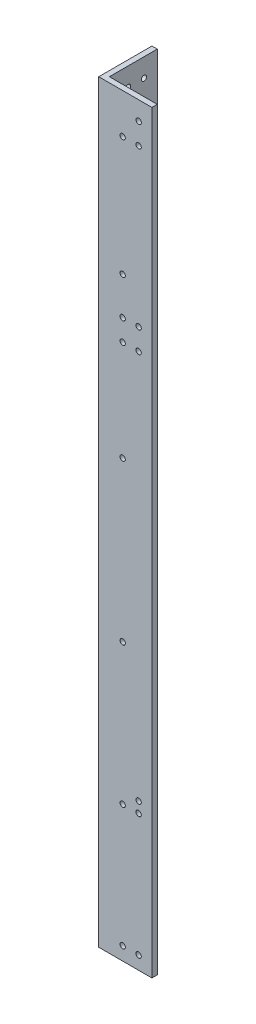
from build123d import *

# Parameters (mm, degrees)
BOSS_EXTRUDE1_DEPTH               = 450
RIGHTSIDEHOLES_SKETCH3_R          = 1.5875
RIGHTSIDEHOLES_CUT_EXTRUDE1_DEPTH = 3.175
FRONTSIDEHOLES_SKETCH4_R          = 1.5875
FRONTSIDEHOLES_SKETCH4_R_2        = 2
FRONTSIDEHOLES_CUT_EXTRUDE2_DEPTH = 3.175


with BuildPart() as part:
    # Sketch2 → Boss-Extrude1 (new body)
    with BuildSketch(Plane(origin=(0, 0, 0), x_dir=(1, 0, 0), z_dir=(0, 1, 0))):
        Polygon((0, 31.75), (3.175, 31.75), (3.175, 3.175), (31.75, 3.175), (31.75, 0), (0, 0), align=None)
    extrude(amount=BOSS_EXTRUDE1_DEPTH)

    # RightSideHoles-Sketch3 → RightSideHoles-Cut-Extrude1 (cut)
    with BuildSketch(Plane.XY):
        with Locations((14.2875, 81.1125)):
            Circle(RIGHTSIDEHOLES_SKETCH3_R)
        with Locations((23.8125, 81.1125)):
            Circle(RIGHTSIDEHOLES_SKETCH3_R)
        with Locations((23.8125, 87.4625)):
            Circle(RIGHTSIDEHOLES_SKETCH3_R)
        with Locations((14.2875, 426.1875)):
            Circle(RIGHTSIDEHOLES_SKETCH3_R)
        with Locations((23.8125, 438.8875)):
            Circle(RIGHTSIDEHOLES_SKETCH3_R)
        with Locations((23.8125, 426.1875)):
            Circle(RIGHTSIDEHOLES_SKETCH3_R)
        with Locations((14.2875, 332.602644)):
            Circle(RIGHTSIDEHOLES_SKETCH3_R)
        with Locations((23.8125, 332.602644)):
            Circle(RIGHTSIDEHOLES_SKETCH3_R)
        with Locations((14.2875, 319.902644)):
            Circle(RIGHTSIDEHOLES_SKETCH3_R)
        with Locations((23.8125, 319.902644)):
            Circle(RIGHTSIDEHOLES_SKETCH3_R)
        with Locations((14.2875, 7.9375)):
            Circle(RIGHTSIDEHOLES_SKETCH3_R)
        with Locations((23.8125, 7.9375)):
            Circle(RIGHTSIDEHOLES_SKETCH3_R)
        with Locations((14.2875, 165)):
            Circle(RIGHTSIDEHOLES_SKETCH3_R)
        with Locations((14.2875, 260)):
            Circle(RIGHTSIDEHOLES_SKETCH3_R)
        with Locations((14.2875, 355)):
            Circle(RIGHTSIDEHOLES_SKETCH3_R)
    extrude(amount=-RIGHTSIDEHOLES_CUT_EXTRUDE1_DEPTH, mode=Mode.SUBTRACT)

    # FrontSideHoles-Sketch4 → FrontSideHoles-Cut-Extrude2 (cut)
    with BuildSketch(Plane.ZY):
        with Locations((-23.8125, 81.1125)):
            Circle(FRONTSIDEHOLES_SKETCH4_R)
        with Locations((-23.8125, 87.4625)):
            Circle(FRONTSIDEHOLES_SKETCH4_R)
        with Locations((-14.2875, 87.4625)):
            Circle(FRONTSIDEHOLES_SKETCH4_R)
        with Locations((-23.8125, 438.8875)):
            Circle(FRONTSIDEHOLES_SKETCH4_R)
        with Locations((-14.2875, 438.8875)):
            Circle(FRONTSIDEHOLES_SKETCH4_R)
        with Locations((-23.8125, 426.1875)):
            Circle(FRONTSIDEHOLES_SKETCH4_R)
        with Locations((-14.2875, 338.177644)):
            Circle(FRONTSIDEHOLES_SKETCH4_R_2)
        with Locations((-14.2875, 319.652644)):
            Circle(FRONTSIDEHOLES_SKETCH4_R_2)
        with Locations((-14.2875, 165)):
            Circle(FRONTSIDEHOLES_SKETCH4_R)
        with Locations((-14.2875, 260)):
            Circle(FRONTSIDEHOLES_SKETCH4_R)
        with Locations((-14.2875, 355)):
            Circle(FRONTSIDEHOLES_SKETCH4_R)
        with Locations((-23.8125, 7.9375)):
            Circle(FRONTSIDEHOLES_SKETCH4_R)
        with Locations((-14.2875, 7.9375)):
            Circle(FRONTSIDEHOLES_SKETCH4_R)
    extrude(amount=-FRONTSIDEHOLES_CUT_EXTRUDE2_DEPTH, mode=Mode.SUBTRACT)


solid = part.part
